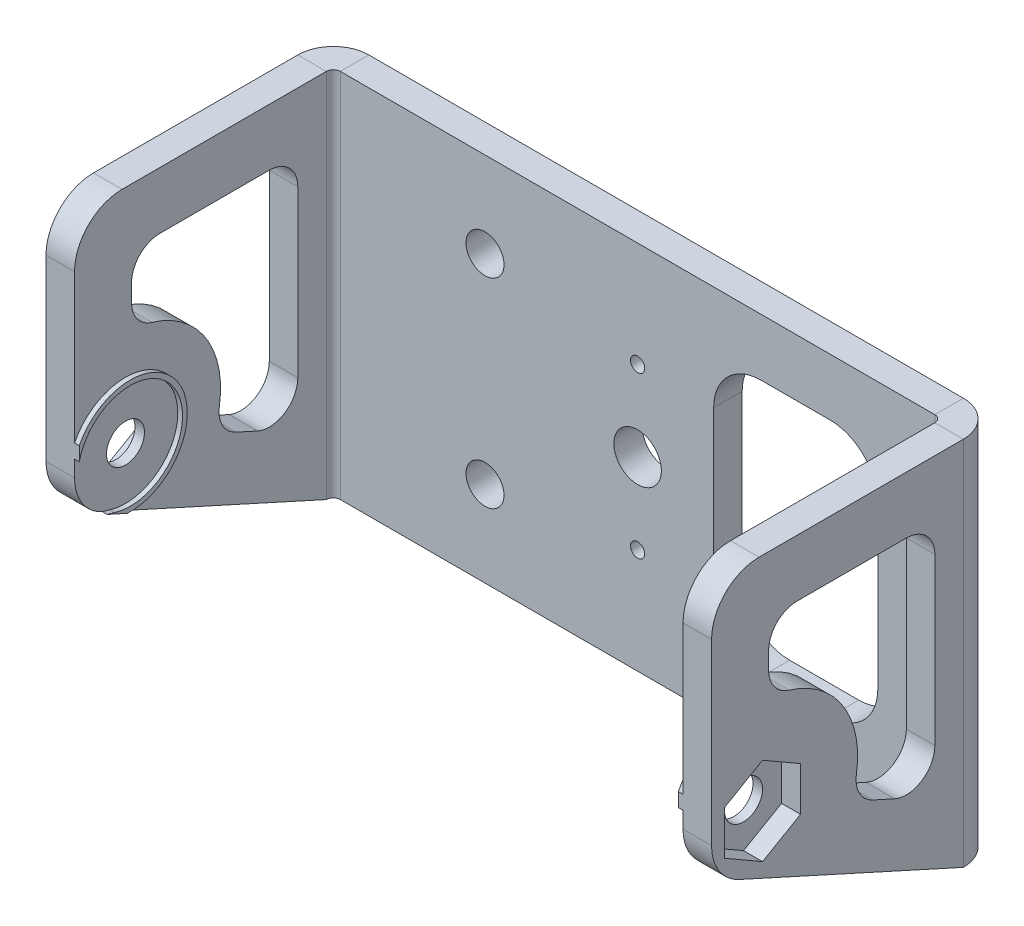
from build123d import *

# Parameters (mm, degrees)
ESBO_O1_W                        = 64
ESBO_O1_H                        = 39
FLANGE_BASE1_DEPTH               = 3
ESBO_O6_R                        = 2
ESBO_O6_R_2                      = 2.5
ESBO_O6_R_3                      = 0.75
CORTE_EXTRUS_O1_DEPTH            = 10
ARESTA_FLANGE1_STRIP_W           = 13.4732
ARESTA_FLANGE1_STRIP_H           = 3
ARESTA_FLANGE1_STRIP_CUT_DEPTH   = 39
ARESTA_FLANGE1_STRIP_2_W         = 13.4732
ARESTA_FLANGE1_STRIP_2_H         = 3
ARESTA_FLANGE1_STRIP_CUT_2_DEPTH = 39
ARESTA_FLANGE1_DEPTH             = 39
ARESTA_FLANGE1_BEND_DEPTH        = 39
CORTE_EXTRUS_O2_REACH            = 80.845
ESBO_O13_R                       = 2
FILETE1_R                        = 5
ESBO_O13_3_R                     = 2
CUT_EXTRUDE1_DEPTH               = 2
BOSS_EXTRUDE1_DEPTH              = 0.5
SKETCH15_W                       = 17.2634
SKETCH15_H                       = 27
CUT_EXTRUDE2_DEPTH               = 3
FILLET1_R                        = 5
CUT_EXTRUDE3_START               = -70
CUT_EXTRUDE3_DEPTH               = 70
FILLET2_R                        = 3


# Sheet-metal steps are written as plain solids
with BuildPart() as part:
    # Esboço1 → Flange-base1 (new body)
    with BuildSketch(Plane.XY):
        with Locations((-5.006264217, -4.490936556)):
            Rectangle(ESBO_O1_W, ESBO_O1_H)
    extrude(amount=-FLANGE_BASE1_DEPTH)

    # Esboço6 → Corte-extrusão1 (cut)
    with BuildSketch(Plane.XY):
        with Locations((-21.056264217, 6.009063444)):
            Circle(ESBO_O6_R)
        with Locations((-21.056264217, -14.990936556)):
            Circle(ESBO_O6_R)
        with Locations((-5.006264217, -4.490936556)):
            Circle(ESBO_O6_R_2)
        with Locations((-5.006264217, -12.940936556)):
            Circle(ESBO_O6_R_3)
        with Locations((-5.006264217, 3.959063444)):
            Circle(ESBO_O6_R_3)
    extrude(amount=-CORTE_EXTRUS_O1_DEPTH, mode=Mode.SUBTRACT)

    # Aresta-Flange1 strip (across the edge) → Aresta-Flange1 strip cut (cut)
    with BuildSketch(Plane(origin=(26.993735783, -23.990936556, 0), x_dir=(-1, 0, 0), z_dir=(0, 1, 0))):
        with Locations((-6, -1.5)):
            Rectangle(ARESTA_FLANGE1_STRIP_W, ARESTA_FLANGE1_STRIP_H)
    extrude(amount=ARESTA_FLANGE1_STRIP_CUT_DEPTH, mode=Mode.SUBTRACT)

    # Aresta-Flange1 strip 2 (across the edge) → Aresta-Flange1 strip cut 2 (cut)
    with BuildSketch(Plane(origin=(-37.006264217, 15.009063444, 0), x_dir=(1, 0, 0), z_dir=(0, -1, 0))):
        with Locations((-6, -1.5)):
            Rectangle(ARESTA_FLANGE1_STRIP_2_W, ARESTA_FLANGE1_STRIP_2_H)
    extrude(amount=ARESTA_FLANGE1_STRIP_CUT_2_DEPTH, mode=Mode.SUBTRACT)

    # Aresta-Flange1 section (across the edge) → Aresta-Flange1 (add)
    with BuildSketch(Plane(origin=(26.993735783, -23.990936556, 0), x_dir=(-1, 0, 0), z_dir=(0, 1, 0))):
        with BuildLine():
            Line((-3, 0.7366), (-3, 27.22))
            Line((-3, 27.22), (0, 27.22))
            Line((0, 27.22), (0, 0.7366))
            ThreePointArc((0, 0.7366), (0.215745145, 0.215745145), (0.7366, 0))
            Line((0.7366, 0), (0.7366, -3))
            ThreePointArc((0.7366, -3), (-1.905575199, -1.905575199), (-3, 0.7366))
        make_face()
    extrude(amount=ARESTA_FLANGE1_DEPTH)

    # Aresta-Flange1 section 2 (across the edge) → Aresta-Flange1 bend (add)
    with BuildSketch(Plane(origin=(-37.006264217, 15.009063444, 0), x_dir=(1, 0, 0), z_dir=(0, -1, 0))):
        with BuildLine():
            Line((-3, 0.7366), (-3, 27.22))
            Line((-3, 27.22), (0, 27.22))
            Line((0, 27.22), (0, 0.7366))
            ThreePointArc((0, 0.7366), (0.215745145, 0.215745145), (0.7366, 0))
            Line((0.7366, 0), (0.7366, -3))
            ThreePointArc((0.7366, -3), (-1.905575199, -1.905575199), (-3, 0.7366))
        make_face()
    extrude(amount=ARESTA_FLANGE1_BEND_DEPTH)

    # Corte-extrusão2: up to this face of the body (flat: up to its plane)
    corte_extrus_o2_end = Plane(part.part.faces().sort_by_distance((29.993735783, -4.490936556, 13.9783))[0])
    # Esboço13 → Corte-extrusão2 (cut, up to the picked face)
    with BuildSketch(Plane.ZY.offset(40.006264217), mode=Mode.PRIVATE) as corte_extrus_o2_sk1:
        with Locations((21.86, -8.287001978)):
            Circle(ESBO_O13_R)
    corte_extrus_o2_tool1 = split(extrude(corte_extrus_o2_sk1.sketch, amount=-CORTE_EXTRUS_O2_REACH, mode=Mode.PRIVATE), bisect_by=corte_extrus_o2_end, keep=Keep.BOTH, mode=Mode.PRIVATE)
    # Esboço13 → Corte-extrusão2 (cut, up to the picked face)
    with BuildSketch(Plane.ZY.offset(40.006264217), mode=Mode.PRIVATE) as corte_extrus_o2_sk2:
        Polygon((27.22, -11.990936556), (0.7366, -23.990936556), (27.22, -23.990936556), align=None)
    corte_extrus_o2_tool2 = split(extrude(corte_extrus_o2_sk2.sketch, amount=-CORTE_EXTRUS_O2_REACH, mode=Mode.PRIVATE), bisect_by=corte_extrus_o2_end, keep=Keep.BOTH, mode=Mode.PRIVATE)
    add(corte_extrus_o2_tool1.solids().sort_by(Axis((-40.006264, -8.287002, 21.86), (1, 0, 0)))[0], mode=Mode.SUBTRACT)
    add(corte_extrus_o2_tool2.solids().sort_by(Axis((-40.006264, -19.990937, 18.3922), (1, 0, 0)))[0], mode=Mode.SUBTRACT)

    # Filete1
    filete1_edges = [part.edges().sort_by_distance(p)[0] for p in [
        (-38.506264217, -11.990936556, 27.22),
        (28.493735783, -11.990936556, 27.22),
        (28.493735783, 15.009063444, 27.22),
        (-38.506264217, 15.009063444, 27.22),
    ]]
    fillet(filete1_edges, radius=FILETE1_R)

    # Esboço13<3> → Cut-Extrude1 (cut)
    with BuildSketch(Plane.ZY.offset(40.006264217)):
        Polygon((21.86, -3.668199824), (17.86, -5.977600901), (17.86, -10.596403054), (21.86, -12.905804131), (25.86, -10.596403054), (25.86, -5.977600901), align=None)
        with Locations((21.86, -8.287001978)):
            Circle(ESBO_O13_3_R, mode=Mode.SUBTRACT)
    cut_extrude1 = extrude(amount=-CUT_EXTRUDE1_DEPTH, mode=Mode.SUBTRACT)

    # Sketch7 → Boss-Extrude1 (add)
    with BuildSketch(Plane(origin=(-37.006264217, 0, 0), x_dir=(0, 0, -1), z_dir=(1, 0, 0))):
        with BuildLine():
            ThreePointArc((-23.546022833, -13.522202738), (-23.915908256, -13.425840182), (-24.283610421, -13.32145586))
            Line((-24.283610421, -13.32145586), (-22.170433783, -14.278965835))
            ThreePointArc((-22.170433783, -14.278965835), (-16.672492687, -5.272077786), (-27.22, -5.59063405))
            Line((-27.22, -5.59063405), (-27.22, -7.053956966))
            ThreePointArc((-27.22, -7.053956966), (-17.36732716, -5.11432318), (-22.490825712, -13.750705751))
            ThreePointArc((-22.490825712, -13.750705751), (-23.024044759, -13.66240892), (-23.546022833, -13.522202738))
        make_face()
    boss_extrude1 = extrude(amount=BOSS_EXTRUDE1_DEPTH)

    # Mirror1: Cut-Extrude1, Boss-Extrude1 across plane
    add(cut_extrude1.mirror(Plane.ZY.offset(5.006264217)), mode=Mode.SUBTRACT)
    add(boss_extrude1.mirror(Plane.ZY.offset(5.006264217)))

    # Sketch15 → Cut-Extrude2 (cut)
    with BuildSketch(Plane.XY):
        with Locations((11.625435783, -4.490936556)):
            Rectangle(SKETCH15_W, SKETCH15_H)
    extrude(amount=-CUT_EXTRUDE2_DEPTH, mode=Mode.SUBTRACT)

    # Fillet1
    fillet1_edges = [part.edges().sort_by_distance(p)[0] for p in [
        (2.993735783, -17.990936556, -1.5),
        (2.993735783, 9.009063444, -1.5),
        (20.257135783, 9.009063444, -1.5),
        (20.257135783, -17.990936556, -1.5),
    ]]
    fillet(fillet1_edges, radius=FILLET1_R)

    # Sketch16 → Cut-Extrude3 (cut)
    with BuildSketch(Plane(origin=(29.993735783, 0, 0), x_dir=(0, 0, -1), z_dir=(1, 0, 0)).offset(CUT_EXTRUDE3_START)):
        with BuildLine():
            Line((-21.22, 9.009063444), (-3.7366, 9.009063444))
            Line((-3.7366, 9.009063444), (-3.7366, -16.044391464))
            Line((-3.7366, -16.044391464), (-12.588351652, -12.033538634))
            ThreePointArc((-12.588351652, -12.033538634), (-13.394705743, -2.963582668), (-21.22, 1.692497008))
            Line((-21.22, 1.692497008), (-21.22, 9.009063444))
        make_face()
    extrude(amount=CUT_EXTRUDE3_DEPTH, mode=Mode.SUBTRACT)

    # Fillet2
    fillet2_edges = [part.edges().sort_by_distance(p)[0] for p in [
        (28.493735783, 1.692497008, 21.22),
        (28.493735783, 9.009063444, 21.22),
        (28.493735783, 9.009063444, 3.7366),
        (28.493735783, -16.044391464, 3.7366),
        (28.493735783, -12.033538634, 12.588351652),
        (-38.506264217, 1.692497008, 21.22),
        (-38.506264217, 9.009063444, 21.22),
        (-38.506264217, 9.009063444, 3.7366),
        (-38.506264217, -16.044391464, 3.7366),
        (-38.506264217, -12.033538634, 12.588351652),
    ]]
    fillet(fillet2_edges, radius=FILLET2_R)


solid = part.part
